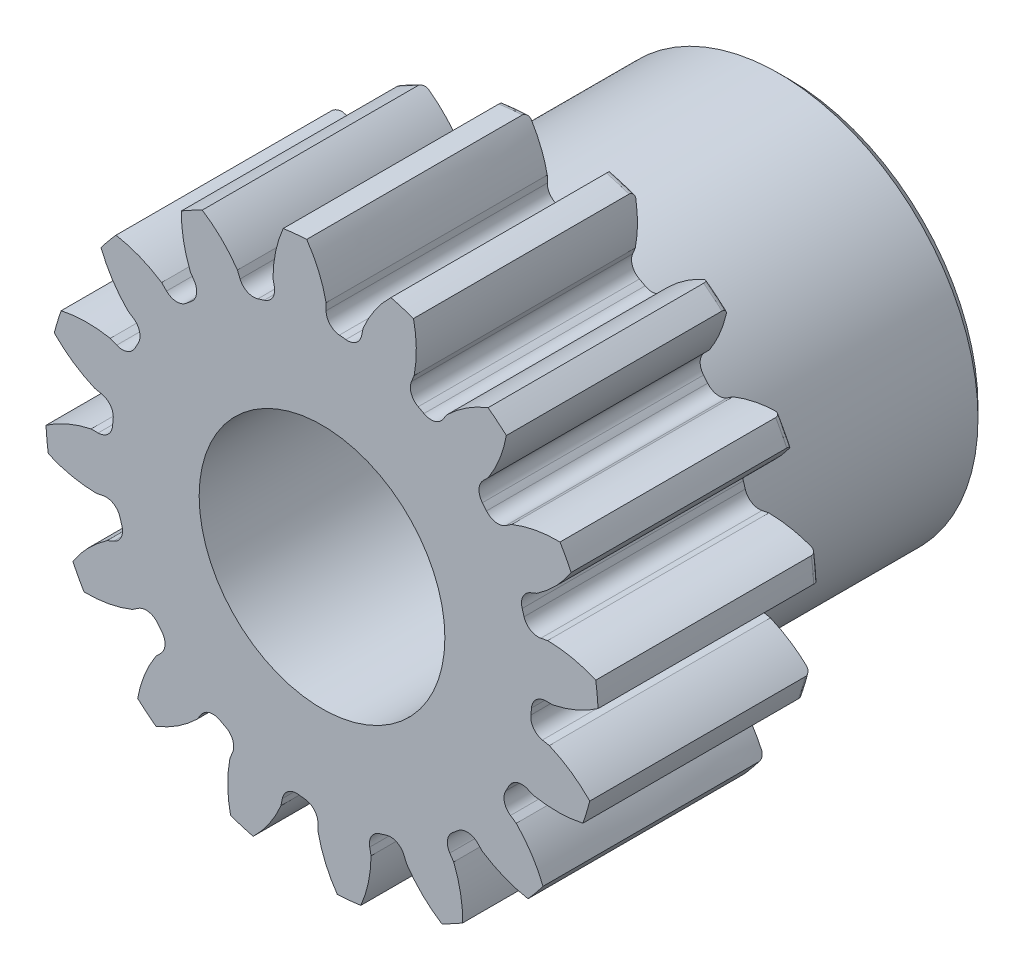
from build123d import *

# Parameters (mm, degrees)
SKETCH1_R                = 14.2875
BOSS_EXTRUDE1_DEPTH      = 19.05
SKETCH2_W                = 12.7
SKETCH2_H                = 10.287
FILLET2_R                = 0.28575
CUT_EXTRUDE1_DEPTH       = 38.634130952
FILLET1_R                = 0.7480935
CIRPATTERN1_COUNT        = 16
FILLET1_OF_CIRPATTERN1_R = 0.7480935
SKETCH5_R                = 6.35
CUT_EXTRUDE2_DEPTH       = 38.617471243
CHAMFER1_SIZE            = 0.51435
SKETCH6_R                = 18.076904476
CUT_EXTRUDE3_DEPTH       = 7.62


with BuildPart() as part:
    # Sketch1 → Boss-Extrude1 (new body)
    with BuildSketch(Plane.XY):
        Circle(SKETCH1_R)
    extrude(amount=-BOSS_EXTRUDE1_DEPTH)

    # Sketch2 → Revolve1 (revolve)
    with BuildSketch(Plane(origin=(0, 0, 0), x_dir=(0, 0, -1), z_dir=(1, 0, 0))):
        with Locations((25.4, 5.1435)):
            Rectangle(SKETCH2_W, SKETCH2_H)
    revolve(axis=Axis((0, 0, -19.05), (0, 0, -1)))

    # Fillet2
    fillet2_edges = [part.edges().sort_by_distance(p)[0] for p in [
        (-14.2875, 0, -19.05),
        (-14.2875, 0, 0),
        (0, -10.287, -19.05),
    ]]
    fillet(fillet2_edges, radius=FILLET2_R)

    # Sketch4 → Cut-Extrude1 (cut, through all)
    with BuildSketch(Plane.XY):
        with BuildLine():
            Line((0.210823499, 11.932233972), (0.210823499, 10.86121658))
            ThreePointArc((0.210823499, 10.86121658), (1.064788407, 10.810952677), (1.912150566, 10.693650095))
            Line((1.912150566, 10.693650095), (2.121096176, 11.744088093))
            add(Edge.make_bspline(
                [(6.521003735, 15.575091257), (3.285842325, 14.461099148), (2.121096176, 11.744088093)],
                knots=[0, 0, 0, 1, 1, 1], degree=2))
            ThreePointArc((6.521003735, 15.575091257), (1.655034105, 16.803803721), (-3.35714731, 16.548006506))
            add(Edge.make_bspline(
                [(-3.35714731, 16.548006506), (-0.40147849, 14.824269404), (0.210823499, 11.932233972)],
                knots=[0, 0, 0, 1, 1, 1], degree=2))
        make_face()
    cut_extrude1 = extrude(amount=-CUT_EXTRUDE1_DEPTH, mode=Mode.SUBTRACT)

    # Fillet1
    fillet1_edges = [part.edges().sort_by_distance(p)[0] for p in [
        (1.912150566, 10.693650095, -9.525),
        (0.210823499, 10.86121658, -9.525),
    ]]
    fillet(fillet1_edges, radius=FILLET1_R)

    # CirPattern1: Cut-Extrude1 ×16 about axis
    cirpattern1_axis = Axis((0, 0, -19.05), (0, 0, 1))
    for i in range(1, CIRPATTERN1_COUNT):
        add(cut_extrude1.rotate(cirpattern1_axis, i * 360 / CIRPATTERN1_COUNT), mode=Mode.SUBTRACT)

    # Fillet1 of CirPattern1
    fillet1_of_cirpattern1_edges = [part.edges().sort_by_distance(p)[0] for p in [
        (-2.325685952, 10.611392792, -9.525),
        (-3.961632125, 10.115134357, -9.525),
        (-6.209457866, 8.91364713, -9.525),
        (-7.53096517, 7.829114621, -9.525),
        (-9.147896109, 5.858879494, -9.525),
        (-9.953777036, 4.351183156, -9.525),
        (-10.693650095, 1.912150566, -9.525),
        (-10.86121658, 0.210823499, -9.525),
        (-10.611392792, -2.325685952, -9.525),
        (-10.115134357, -3.961632125, -9.525),
        (-8.91364713, -6.209457866, -9.525),
        (-7.829114621, -7.53096517, -9.525),
        (-5.858879494, -9.147896109, -9.525),
        (-4.351183156, -9.953777036, -9.525),
        (-1.912150566, -10.693650095, -9.525),
        (-0.210823499, -10.86121658, -9.525),
        (2.325685952, -10.611392792, -9.525),
        (3.961632125, -10.115134357, -9.525),
        (6.209457866, -8.91364713, -9.525),
        (7.53096517, -7.829114621, -9.525),
        (9.147896109, -5.858879494, -9.525),
        (9.953777036, -4.351183156, -9.525),
        (10.693650095, -1.912150566, -9.525),
        (10.86121658, -0.210823499, -9.525),
        (10.611392792, 2.325685952, -9.525),
        (10.115134357, 3.961632125, -9.525),
        (8.91364713, 6.209457866, -9.525),
        (7.829114621, 7.53096517, -9.525),
        (5.858879494, 9.147896109, -9.525),
        (4.351183156, 9.953777036, -9.525),
    ]]
    fillet(fillet1_of_cirpattern1_edges, radius=FILLET1_OF_CIRPATTERN1_R)

    # Sketch5 → Cut-Extrude2 (cut, through all)
    with BuildSketch(Plane.XY):
        Circle(SKETCH5_R)
    extrude(amount=-CUT_EXTRUDE2_DEPTH, mode=Mode.SUBTRACT)

    # Chamfer1
    chamfer1_edges = [part.edges().sort_by_distance(p)[0] for p in [
        (0, -10.287, -31.75),
        (-6.35, 0, 0),
        (-6.35, 0, -31.75),
    ]]
    chamfer(chamfer1_edges, length=CHAMFER1_SIZE)

    # Sketch6 → Cut-Extrude3 (cut)
    with BuildSketch(Plane.XY):
        Circle(SKETCH6_R)
    extrude(amount=-CUT_EXTRUDE3_DEPTH, mode=Mode.SUBTRACT)


solid = part.part
